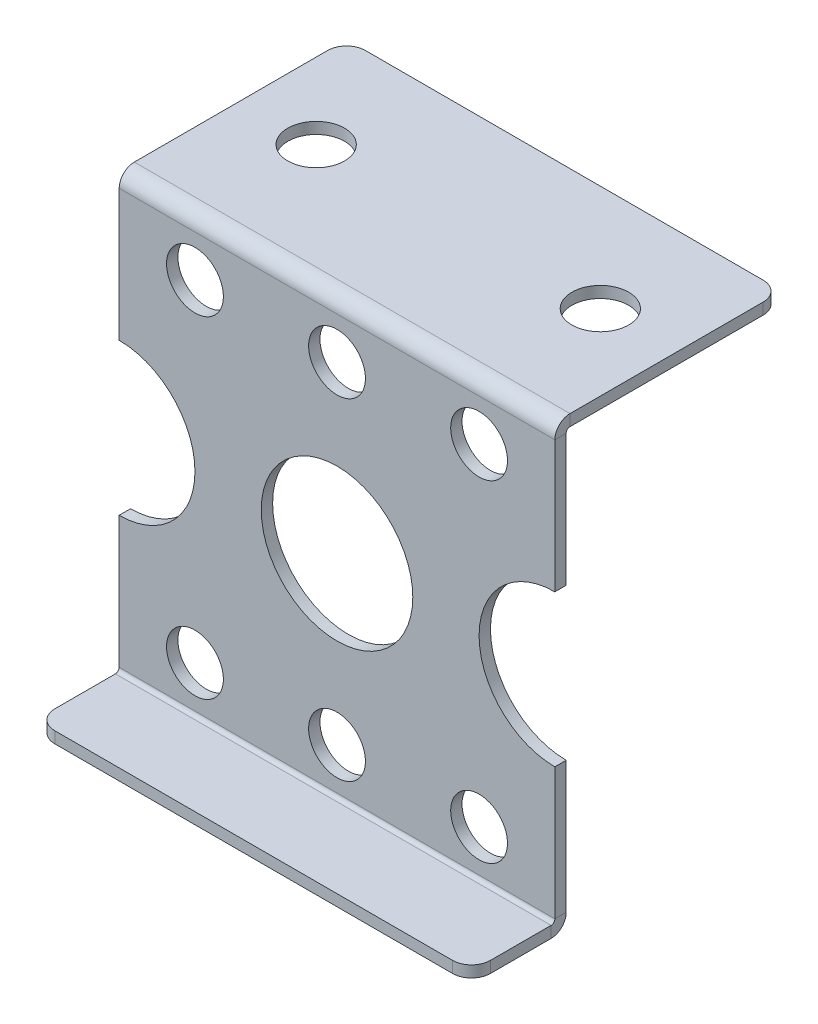
from build123d import *

# Parameters (mm, degrees)
SKETCH1_R                    = 4
BOSS_EXTRUDE1_DEPTH          = 0.6
EDGE_FLANGE1_STRIP_W         = 2.8
EDGE_FLANGE1_STRIP_H         = 0.6
EDGE_FLANGE1_STRIP_CUT_DEPTH = 23
EDGE_FLANGE1_DEPTH           = 23
SKETCH14_R                   = 1.5
CUT_EXTRUDE3_DEPTH           = 21.00681134
EDGE_FLANGE2_STRIP_W         = 2.8
EDGE_FLANGE2_STRIP_H         = 0.6
EDGE_FLANGE2_STRIP_CUT_DEPTH = 23
EDGE_FLANGE2_DEPTH           = 23
SKETCH13_R                   = 1.5
CUT_EXTRUDE1_DEPTH           = 29.046746692
FILLET2_R                    = 1


# Sheet-metal steps are written as plain solids
with BuildPart() as part:
    # Sketch1 → Boss-Extrude1 (new body)
    with BuildSketch(Plane.XY):
        with BuildLine():
            Line((11.5, -4), (11.5, -11.75))
            Line((11.5, -11.75), (-11.5, -11.75))
            Line((-11.5, -11.75), (-11.5, -4))
            ThreePointArc((-11.5, -4), (-7.5, 0), (-11.5, 4))
            Line((-11.5, 4), (-11.5, 11.75))
            Line((-11.5, 11.75), (11.5, 11.75))
            Line((11.5, 11.75), (11.5, 4))
            ThreePointArc((11.5, 4), (7.5, 0), (11.5, -4))
        make_face()
        Circle(SKETCH1_R, mode=Mode.SUBTRACT)
    extrude(amount=BOSS_EXTRUDE1_DEPTH)

    # Edge-Flange1 strip (across the edge) → Edge-Flange1 strip cut (cut)
    with BuildSketch(Plane(origin=(-11.5, 11.75, 0), x_dir=(0, -1, 0), z_dir=(1, 0, 0))):
        with Locations((-0.6, -0.3)):
            Rectangle(EDGE_FLANGE1_STRIP_W, EDGE_FLANGE1_STRIP_H)
    extrude(amount=EDGE_FLANGE1_STRIP_CUT_DEPTH, mode=Mode.SUBTRACT)

    # Edge-Flange1 section (across the edge) → Edge-Flange1 (add)
    with BuildSketch(Plane(origin=(-11.5, 11.75, 0), x_dir=(0, -1, 0), z_dir=(1, 0, 0))):
        with BuildLine():
            Line((0, 0.2), (0, 11.4))
            Line((0, 11.4), (0.6, 11.4))
            Line((0.6, 11.4), (0.6, 0.2))
            ThreePointArc((0.6, 0.2), (0.658578644, 0.058578644), (0.8, 0))
            Line((0.8, 0), (0.8, -0.6))
            ThreePointArc((0.8, -0.6), (0.234314575, -0.365685425), (0, 0.2))
        make_face()
    extrude(amount=EDGE_FLANGE1_DEPTH)

    # Sketch14 → Cut-Extrude3 (cut, through all)
    with BuildSketch(Plane(origin=(0, 0, 0), x_dir=(-1, 0, 0), z_dir=(0, 0, -1))):
        with Locations((-7.5, -8.75)):
            Circle(SKETCH14_R)
        with Locations((0, -8.75)):
            Circle(SKETCH14_R)
        with Locations((7.5, -8.75)):
            Circle(SKETCH14_R)
        with Locations((7.5, 8.75)):
            Circle(SKETCH14_R)
        with Locations((0, 8.75)):
            Circle(SKETCH14_R)
        with Locations((-7.5, 8.75)):
            Circle(SKETCH14_R)
    extrude(amount=-CUT_EXTRUDE3_DEPTH, mode=Mode.SUBTRACT)

    # Edge-Flange2 strip (across the edge) → Edge-Flange2 strip cut (cut)
    with BuildSketch(Plane(origin=(-11.5, -11.75, 0.6), x_dir=(0, 1, 0), z_dir=(1, 0, 0))):
        with Locations((-0.6, -0.3)):
            Rectangle(EDGE_FLANGE2_STRIP_W, EDGE_FLANGE2_STRIP_H)
    extrude(amount=EDGE_FLANGE2_STRIP_CUT_DEPTH, mode=Mode.SUBTRACT)

    # Edge-Flange2 section (across the edge) → Edge-Flange2 (add)
    with BuildSketch(Plane(origin=(-11.5, -11.75, 0.6), x_dir=(0, 1, 0), z_dir=(1, 0, 0))):
        with BuildLine():
            Line((0, 0.2), (0, 4.4))
            Line((0, 4.4), (0.6, 4.4))
            Line((0.6, 4.4), (0.6, 0.2))
            ThreePointArc((0.6, 0.2), (0.658578644, 0.058578644), (0.8, 0))
            Line((0.8, 0), (0.8, -0.6))
            ThreePointArc((0.8, -0.6), (0.234314575, -0.365685425), (0, 0.2))
        make_face()
    extrude(amount=EDGE_FLANGE2_DEPTH)

    # Sketch13 → Cut-Extrude1 (cut, through all)
    with BuildSketch(Plane.XZ.offset(-11.15)):
        with Locations(Location((7.5, -5.8, 0), (0, 0, 270))):
            Circle(SKETCH13_R)
        with Locations(Location((-7.5, -5.8, 0), (0, 0, 90))):
            Circle(SKETCH13_R)
    extrude(amount=-CUT_EXTRUDE1_DEPTH, mode=Mode.SUBTRACT)

    # Fillet2
    fillet2_edges = [part.edges().sort_by_distance(p)[0] for p in [
        (-11.5, -11.45, 5),
        (11.5, -11.45, 5),
        (-11.5, 11.45, -11.4),
        (11.5, 11.45, -11.4),
    ]]
    fillet(fillet2_edges, radius=FILLET2_R)


solid = part.part
